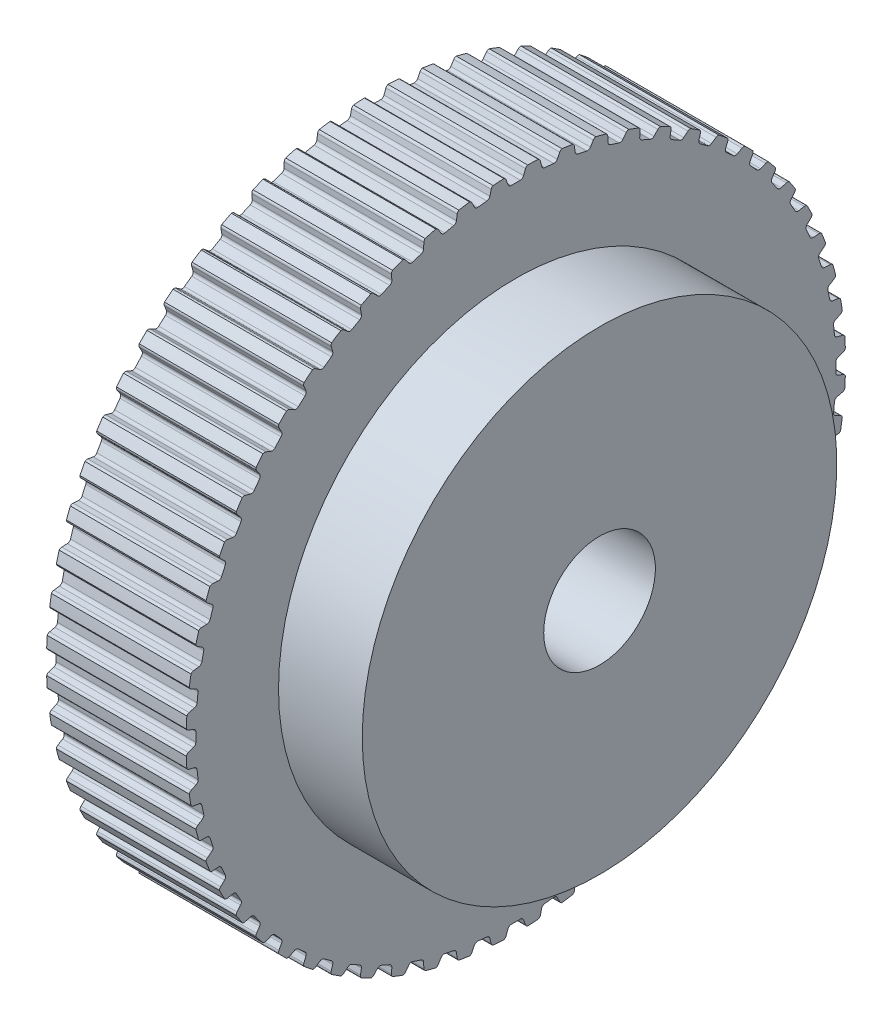
from build123d import *

# Parameters (mm, degrees)
BOSS_EXTRUDE1_DEPTH      = 10
SKETCH2_W                = 6
SKETCH2_H                = 17
F_8_0_8_DIAMETER_HOLE1_D = 8
FILLET1_R                = 0.25


with BuildPart() as part:
    # Sketch1 → Boss-Extrude1 (new body)
    with BuildSketch(Plane(origin=(0, 0, 0), x_dir=(0, -1, 0), z_dir=(-1, 0, 0))):
        with BuildLine():
            Line((-23.404623589, -1.761189424), (-22.851678683, -1.899054073))
            Line((-22.851678683, -1.899054073), (-22.74715022, -2.893575968))
            Line((-22.74715022, -2.893575968), (-23.25934828, -3.143391654))
            ThreePointArc((-23.25934828, -3.143391654), (-23.344028986, -3.210744018), (-23.392319429, -3.307569612))
            ThreePointArc((-23.392319429, -3.307569612), (-23.334137047, -3.695764237), (-23.269513044, -4.082938608))
            ThreePointArc((-23.269513044, -4.082938608), (-23.193665349, -4.160102654), (-23.092316188, -4.197990781))
            Line((-23.092316188, -4.197990781), (-22.527989592, -4.277301712))
            Line((-22.527989592, -4.277301712), (-22.320077901, -5.255449312))
            Line((-22.320077901, -5.255449312), (-22.803357238, -5.557435758))
            ThreePointArc((-22.803357238, -5.557435758), (-22.880533814, -5.633270702), (-22.918438687, -5.734613602))
            ThreePointArc((-22.918438687, -5.734613602), (-22.819997646, -6.114599941), (-22.715256919, -6.492898283))
            ThreePointArc((-22.715256919, -6.492898283), (-22.631758886, -6.561711373), (-22.527004538, -6.588798073))
            Line((-22.527004538, -6.588798073), (-21.957479133, -6.608686338))
            Line((-21.957479133, -6.608686338), (-21.648462139, -7.559742854))
            Line((-21.648462139, -7.559742854), (-22.097527841, -7.910591433))
            ThreePointArc((-22.097527841, -7.910591433), (-22.166354726, -7.994078094), (-22.193458734, -8.098827965))
            ThreePointArc((-22.193458734, -8.098827965), (-22.055837576, -8.466442808), (-21.912127685, -8.831720405))
            ThreePointArc((-21.912127685, -8.831720405), (-21.821894137, -8.891428609), (-21.714882313, -8.907417114))
            Line((-21.714882313, -8.907417114), (-21.146397938, -8.867664814))
            Line((-21.146397938, -8.867664814), (-20.739661295, -9.781210271))
            Line((-20.739661295, -9.781210271), (-21.149593306, -10.177077013))
            ThreePointArc((-21.149593306, -10.177077013), (-21.209316417, -10.267300694), (-21.225322604, -10.374309874))
            ThreePointArc((-21.225322604, -10.374309874), (-21.050029134, -10.725525556), (-20.868924595, -11.073780351))
            ThreePointArc((-20.868924595, -11.073780351), (-20.772944149, -11.123729492), (-20.664847293, -11.128444629))
            Line((-20.664847293, -11.128444629), (-20.103632382, -11.029487298))
            Line((-20.103632382, -11.029487298), (-19.603632382, -11.895512702))
            Line((-19.603632382, -11.895512702), (-19.9699394, -12.332060407))
            ThreePointArc((-19.9699394, -12.332060407), (-20.019904399, -12.428032598), (-20.024637397, -12.536128674))
            ThreePointArc((-20.024637397, -12.536128674), (-19.813592168, -12.867097202), (-19.5970772, -13.194513641))
            ThreePointArc((-19.5970772, -13.194513641), (-19.496401438, -13.234156467), (-19.388403882, -13.227546576))
            Line((-19.388403882, -13.227546576), (-18.840607222, -13.070468412))
            Line((-18.840607222, -13.070468412), (-18.25282197, -13.879485406))
            Line((-18.25282197, -13.879485406), (-18.571490659, -14.351931167))
            ThreePointArc((-18.571490659, -14.351931167), (-18.611150119, -14.452600377), (-18.604558073, -14.560599024))
            ThreePointArc((-18.604558073, -14.560599024), (-18.360073339, -14.867694239), (-18.110520126, -15.170685079))
            ThreePointArc((-18.110520126, -15.170685079), (-18.006252073, -15.199587255), (-17.899537061, -15.181724755))
            Line((-17.899537061, -15.181724755), (-17.371160427, -14.968246738))
            Line((-17.371160427, -14.968246738), (-16.702029821, -15.711391564))
            Line((-16.702029821, -15.711391564), (-16.96956878, -16.214559165))
            ThreePointArc((-16.96956878, -16.214559165), (-16.998488184, -16.318822442), (-16.980643317, -16.425540404))
            ThreePointArc((-16.980643317, -16.425540404), (-16.705397706, -16.705397706), (-16.425540404, -16.980643317))
            ThreePointArc((-16.425540404, -16.980643317), (-16.318822442, -16.998488184), (-16.214559165, -16.96956878))
            Line((-16.214559165, -16.96956878), (-15.711391564, -16.702029821))
            Line((-15.711391564, -16.702029821), (-14.968246738, -17.371160427))
            Line((-14.968246738, -17.371160427), (-15.181724755, -17.899537061))
            ThreePointArc((-15.181724755, -17.899537061), (-15.199587255, -18.006252073), (-15.170685079, -18.110520126))
            ThreePointArc((-15.170685079, -18.110520126), (-14.867694239, -18.360073339), (-14.560599024, -18.604558073))
            ThreePointArc((-14.560599024, -18.604558073), (-14.452600377, -18.611150119), (-14.351931167, -18.571490659))
            Line((-14.351931167, -18.571490659), (-13.879485406, -18.25282197))
            Line((-13.879485406, -18.25282197), (-13.070468412, -18.840607222))
            Line((-13.070468412, -18.840607222), (-13.227546576, -19.388403882))
            ThreePointArc((-13.227546576, -19.388403882), (-13.234156467, -19.496401438), (-13.194513641, -19.5970772))
            ThreePointArc((-13.194513641, -19.5970772), (-12.867097202, -19.813592168), (-12.536128674, -20.024637397))
            ThreePointArc((-12.536128674, -20.024637397), (-12.428032598, -20.019904399), (-12.332060407, -19.9699394))
            Line((-12.332060407, -19.9699394), (-11.895512702, -19.603632382))
            Line((-11.895512702, -19.603632382), (-11.029487298, -20.103632382))
            Line((-11.029487298, -20.103632382), (-11.128444629, -20.664847293))
            ThreePointArc((-11.128444629, -20.664847293), (-11.123729492, -20.772944149), (-11.073780351, -20.868924595))
            ThreePointArc((-11.073780351, -20.868924595), (-10.725525556, -21.050029134), (-10.374309874, -21.225322604))
            ThreePointArc((-10.374309874, -21.225322604), (-10.267300694, -21.209316417), (-10.177077013, -21.149593306))
            Line((-10.177077013, -21.149593306), (-9.781210271, -20.739661295))
            Line((-9.781210271, -20.739661295), (-8.867664814, -21.146397938))
            Line((-8.867664814, -21.146397938), (-8.907417114, -21.714882313))
            ThreePointArc((-8.907417114, -21.714882313), (-8.891428609, -21.821894137), (-8.831720405, -21.912127685))
            ThreePointArc((-8.831720405, -21.912127685), (-8.466442808, -22.055837576), (-8.098827965, -22.193458734))
            ThreePointArc((-8.098827965, -22.193458734), (-7.994078094, -22.166354726), (-7.910591433, -22.097527841))
            Line((-7.910591433, -22.097527841), (-7.559742854, -21.648462139))
            Line((-7.559742854, -21.648462139), (-6.608686338, -21.957479133))
            Line((-6.608686338, -21.957479133), (-6.588798073, -22.527004538))
            ThreePointArc((-6.588798073, -22.527004538), (-6.561711373, -22.631758886), (-6.492898283, -22.715256919))
            ThreePointArc((-6.492898283, -22.715256919), (-6.114599941, -22.819997646), (-5.734613602, -22.918438687))
            ThreePointArc((-5.734613602, -22.918438687), (-5.633270702, -22.880533814), (-5.557435758, -22.803357238))
            Line((-5.557435758, -22.803357238), (-5.255449312, -22.320077901))
            Line((-5.255449312, -22.320077901), (-4.277301712, -22.527989592))
            Line((-4.277301712, -22.527989592), (-4.197990781, -23.092316188))
            ThreePointArc((-4.197990781, -23.092316188), (-4.160102654, -23.193665349), (-4.082938608, -23.269513044))
            ThreePointArc((-4.082938608, -23.269513044), (-3.695764237, -23.334137047), (-3.307569612, -23.392319429))
            ThreePointArc((-3.307569612, -23.392319429), (-3.210744018, -23.344028986), (-3.143391654, -23.25934828))
            Line((-3.143391654, -23.25934828), (-2.893575968, -22.74715022))
            Line((-2.893575968, -22.74715022), (-1.899054073, -22.851678683))
            Line((-1.899054073, -22.851678683), (-1.761189424, -23.404623589))
            ThreePointArc((-1.761189424, -23.404623589), (-1.71291498, -23.501457161), (-1.628245404, -23.568823515))
            ThreePointArc((-1.628245404, -23.568823515), (-1.236436966, -23.592622759), (-0.844287198, -23.609909024))
            ThreePointArc((-0.844287198, -23.609909024), (-0.75303975, -23.55176209), (-0.694907893, -23.460505036))
            Line((-0.694907893, -23.460505036), (-0.5, -22.925))
            Line((-0.5, -22.925), (0.5, -22.925))
            Line((0.5, -22.925), (0.694907893, -23.460505036))
            ThreePointArc((0.694907893, -23.460505036), (0.75303975, -23.55176209), (0.844287198, -23.609909024))
            ThreePointArc((0.844287198, -23.609909024), (1.236436966, -23.592622759), (1.628245404, -23.568823515))
            ThreePointArc((1.628245404, -23.568823515), (1.71291498, -23.501457161), (1.761189424, -23.404623589))
            Line((1.761189424, -23.404623589), (1.899054073, -22.851678683))
            Line((1.899054073, -22.851678683), (2.893575968, -22.74715022))
            Line((2.893575968, -22.74715022), (3.143391654, -23.25934828))
            ThreePointArc((3.143391654, -23.25934828), (3.210744018, -23.344028986), (3.307569612, -23.392319429))
            ThreePointArc((3.307569612, -23.392319429), (3.695764237, -23.334137047), (4.082938608, -23.269513044))
            ThreePointArc((4.082938608, -23.269513044), (4.160102654, -23.193665349), (4.197990781, -23.092316188))
            Line((4.197990781, -23.092316188), (4.277301712, -22.527989592))
            Line((4.277301712, -22.527989592), (5.255449312, -22.320077901))
            Line((5.255449312, -22.320077901), (5.557435758, -22.803357238))
            ThreePointArc((5.557435758, -22.803357238), (5.633270702, -22.880533814), (5.734613602, -22.918438687))
            ThreePointArc((5.734613602, -22.918438687), (6.114599941, -22.819997646), (6.492898283, -22.715256919))
            ThreePointArc((6.492898283, -22.715256919), (6.561711373, -22.631758886), (6.588798073, -22.527004538))
            Line((6.588798073, -22.527004538), (6.608686338, -21.957479133))
            Line((6.608686338, -21.957479133), (7.559742854, -21.648462139))
            Line((7.559742854, -21.648462139), (7.910591433, -22.097527841))
            ThreePointArc((7.910591433, -22.097527841), (7.994078094, -22.166354726), (8.098827965, -22.193458734))
            ThreePointArc((8.098827965, -22.193458734), (8.466442808, -22.055837576), (8.831720405, -21.912127685))
            ThreePointArc((8.831720405, -21.912127685), (8.891428609, -21.821894137), (8.907417114, -21.714882313))
            Line((8.907417114, -21.714882313), (8.867664814, -21.146397938))
            Line((8.867664814, -21.146397938), (9.781210271, -20.739661295))
            Line((9.781210271, -20.739661295), (10.177077013, -21.149593306))
            ThreePointArc((10.177077013, -21.149593306), (10.267300694, -21.209316417), (10.374309874, -21.225322604))
            ThreePointArc((10.374309874, -21.225322604), (10.725525556, -21.050029134), (11.073780351, -20.868924595))
            ThreePointArc((11.073780351, -20.868924595), (11.123729492, -20.772944149), (11.128444629, -20.664847293))
            Line((11.128444629, -20.664847293), (11.029487298, -20.103632382))
            Line((11.029487298, -20.103632382), (11.895512702, -19.603632382))
            Line((11.895512702, -19.603632382), (12.332060407, -19.9699394))
            ThreePointArc((12.332060407, -19.9699394), (12.428032598, -20.019904399), (12.536128674, -20.024637397))
            ThreePointArc((12.536128674, -20.024637397), (12.867097202, -19.813592168), (13.194513641, -19.5970772))
            ThreePointArc((13.194513641, -19.5970772), (13.234156467, -19.496401438), (13.227546576, -19.388403882))
            Line((13.227546576, -19.388403882), (13.070468412, -18.840607222))
            Line((13.070468412, -18.840607222), (13.879485406, -18.25282197))
            Line((13.879485406, -18.25282197), (14.351931167, -18.571490659))
            ThreePointArc((14.351931167, -18.571490659), (14.452600377, -18.611150119), (14.560599024, -18.604558073))
            ThreePointArc((14.560599024, -18.604558073), (14.867694239, -18.360073339), (15.170685079, -18.110520126))
            ThreePointArc((15.170685079, -18.110520126), (15.199587255, -18.006252073), (15.181724755, -17.899537061))
            Line((15.181724755, -17.899537061), (14.968246738, -17.371160427))
            Line((14.968246738, -17.371160427), (15.711391564, -16.702029821))
            Line((15.711391564, -16.702029821), (16.214559165, -16.96956878))
            ThreePointArc((16.214559165, -16.96956878), (16.318822442, -16.998488184), (16.425540404, -16.980643317))
            ThreePointArc((16.425540404, -16.980643317), (16.705397706, -16.705397706), (16.980643317, -16.425540404))
            ThreePointArc((16.980643317, -16.425540404), (16.998488184, -16.318822442), (16.96956878, -16.214559165))
            Line((16.96956878, -16.214559165), (16.702029821, -15.711391564))
            Line((16.702029821, -15.711391564), (17.371160427, -14.968246738))
            Line((17.371160427, -14.968246738), (17.899537061, -15.181724755))
            ThreePointArc((17.899537061, -15.181724755), (18.006252073, -15.199587255), (18.110520126, -15.170685079))
            ThreePointArc((18.110520126, -15.170685079), (18.360073339, -14.867694239), (18.604558073, -14.560599024))
            ThreePointArc((18.604558073, -14.560599024), (18.611150119, -14.452600377), (18.571490659, -14.351931167))
            Line((18.571490659, -14.351931167), (18.25282197, -13.879485406))
            Line((18.25282197, -13.879485406), (18.840607222, -13.070468412))
            Line((18.840607222, -13.070468412), (19.388403882, -13.227546576))
            ThreePointArc((19.388403882, -13.227546576), (19.496401438, -13.234156467), (19.5970772, -13.194513641))
            ThreePointArc((19.5970772, -13.194513641), (19.813592168, -12.867097202), (20.024637397, -12.536128674))
            ThreePointArc((20.024637397, -12.536128674), (20.019904399, -12.428032598), (19.9699394, -12.332060407))
            Line((19.9699394, -12.332060407), (19.603632382, -11.895512702))
            Line((19.603632382, -11.895512702), (20.103632382, -11.029487298))
            Line((20.103632382, -11.029487298), (20.664847293, -11.128444629))
            ThreePointArc((20.664847293, -11.128444629), (20.772944149, -11.123729492), (20.868924595, -11.073780351))
            ThreePointArc((20.868924595, -11.073780351), (21.050029134, -10.725525556), (21.225322604, -10.374309874))
            ThreePointArc((21.225322604, -10.374309874), (21.209316417, -10.267300694), (21.149593306, -10.177077013))
            Line((21.149593306, -10.177077013), (20.739661295, -9.781210271))
            Line((20.739661295, -9.781210271), (21.146397938, -8.867664814))
            Line((21.146397938, -8.867664814), (21.714882313, -8.907417114))
            ThreePointArc((21.714882313, -8.907417114), (21.821894137, -8.891428609), (21.912127685, -8.831720405))
            ThreePointArc((21.912127685, -8.831720405), (22.055837576, -8.466442808), (22.193458734, -8.098827965))
            ThreePointArc((22.193458734, -8.098827965), (22.166354726, -7.994078094), (22.097527841, -7.910591433))
            Line((22.097527841, -7.910591433), (21.648462139, -7.559742854))
            Line((21.648462139, -7.559742854), (21.957479133, -6.608686338))
            Line((21.957479133, -6.608686338), (22.527004538, -6.588798073))
            ThreePointArc((22.527004538, -6.588798073), (22.631758886, -6.561711373), (22.715256919, -6.492898283))
            ThreePointArc((22.715256919, -6.492898283), (22.819997646, -6.114599941), (22.918438687, -5.734613602))
            ThreePointArc((22.918438687, -5.734613602), (22.880533814, -5.633270702), (22.803357238, -5.557435758))
            Line((22.803357238, -5.557435758), (22.320077901, -5.255449312))
            Line((22.320077901, -5.255449312), (22.527989592, -4.277301712))
            Line((22.527989592, -4.277301712), (23.092316188, -4.197990781))
            ThreePointArc((23.092316188, -4.197990781), (23.193665349, -4.160102654), (23.269513044, -4.082938608))
            ThreePointArc((23.269513044, -4.082938608), (23.334137047, -3.695764237), (23.392319429, -3.307569612))
            ThreePointArc((23.392319429, -3.307569612), (23.344028986, -3.210744018), (23.25934828, -3.143391654))
            Line((23.25934828, -3.143391654), (22.74715022, -2.893575968))
            Line((22.74715022, -2.893575968), (22.851678683, -1.899054073))
            Line((22.851678683, -1.899054073), (23.404623589, -1.761189424))
            ThreePointArc((23.404623589, -1.761189424), (23.501457161, -1.71291498), (23.568823515, -1.628245404))
            ThreePointArc((23.568823515, -1.628245404), (23.592622759, -1.236436966), (23.609909024, -0.844287198))
            ThreePointArc((23.609909024, -0.844287198), (23.55176209, -0.75303975), (23.460505036, -0.694907893))
            Line((23.460505036, -0.694907893), (22.925, -0.5))
            Line((22.925, -0.5), (22.925, 0.5))
            Line((22.925, 0.5), (23.460505036, 0.694907893))
            ThreePointArc((23.460505036, 0.694907893), (23.55176209, 0.75303975), (23.609909024, 0.844287198))
            ThreePointArc((23.609909024, 0.844287198), (23.592622759, 1.236436966), (23.568823515, 1.628245404))
            ThreePointArc((23.568823515, 1.628245404), (23.501457161, 1.71291498), (23.404623589, 1.761189424))
            Line((23.404623589, 1.761189424), (22.851678683, 1.899054073))
            Line((22.851678683, 1.899054073), (22.74715022, 2.893575968))
            Line((22.74715022, 2.893575968), (23.25934828, 3.143391654))
            ThreePointArc((23.25934828, 3.143391654), (23.344028986, 3.210744018), (23.392319429, 3.307569612))
            ThreePointArc((23.392319429, 3.307569612), (23.334137047, 3.695764237), (23.269513044, 4.082938608))
            ThreePointArc((23.269513044, 4.082938608), (23.193665349, 4.160102654), (23.092316188, 4.197990781))
            Line((23.092316188, 4.197990781), (22.527989592, 4.277301712))
            Line((22.527989592, 4.277301712), (22.320077901, 5.255449312))
            Line((22.320077901, 5.255449312), (22.803357238, 5.557435758))
            ThreePointArc((22.803357238, 5.557435758), (22.880533814, 5.633270702), (22.918438687, 5.734613602))
            ThreePointArc((22.918438687, 5.734613602), (22.819997646, 6.114599941), (22.715256919, 6.492898283))
            ThreePointArc((22.715256919, 6.492898283), (22.631758886, 6.561711373), (22.527004538, 6.588798073))
            Line((22.527004538, 6.588798073), (21.957479133, 6.608686338))
            Line((21.957479133, 6.608686338), (21.648462139, 7.559742854))
            Line((21.648462139, 7.559742854), (22.097527841, 7.910591433))
            ThreePointArc((22.097527841, 7.910591433), (22.166354726, 7.994078094), (22.193458734, 8.098827965))
            ThreePointArc((22.193458734, 8.098827965), (22.055837576, 8.466442808), (21.912127685, 8.831720405))
            ThreePointArc((21.912127685, 8.831720405), (21.821894137, 8.891428609), (21.714882313, 8.907417114))
            Line((21.714882313, 8.907417114), (21.146397938, 8.867664814))
            Line((21.146397938, 8.867664814), (20.739661295, 9.781210271))
            Line((20.739661295, 9.781210271), (21.149593306, 10.177077013))
            ThreePointArc((21.149593306, 10.177077013), (21.209316417, 10.267300694), (21.225322604, 10.374309874))
            ThreePointArc((21.225322604, 10.374309874), (21.050029134, 10.725525556), (20.868924595, 11.073780351))
            ThreePointArc((20.868924595, 11.073780351), (20.772944149, 11.123729492), (20.664847293, 11.128444629))
            Line((20.664847293, 11.128444629), (20.103632382, 11.029487298))
            Line((20.103632382, 11.029487298), (19.603632382, 11.895512702))
            Line((19.603632382, 11.895512702), (19.9699394, 12.332060407))
            ThreePointArc((19.9699394, 12.332060407), (20.019904399, 12.428032598), (20.024637397, 12.536128674))
            ThreePointArc((20.024637397, 12.536128674), (19.813592168, 12.867097202), (19.5970772, 13.194513641))
            ThreePointArc((19.5970772, 13.194513641), (19.496401438, 13.234156467), (19.388403882, 13.227546576))
            Line((19.388403882, 13.227546576), (18.840607222, 13.070468412))
            Line((18.840607222, 13.070468412), (18.25282197, 13.879485406))
            Line((18.25282197, 13.879485406), (18.571490659, 14.351931167))
            ThreePointArc((18.571490659, 14.351931167), (18.611150119, 14.452600377), (18.604558073, 14.560599024))
            ThreePointArc((18.604558073, 14.560599024), (18.360073339, 14.867694239), (18.110520126, 15.170685079))
            ThreePointArc((18.110520126, 15.170685079), (18.006252073, 15.199587255), (17.899537061, 15.181724755))
            Line((17.899537061, 15.181724755), (17.371160427, 14.968246738))
            Line((17.371160427, 14.968246738), (16.702029821, 15.711391564))
            Line((16.702029821, 15.711391564), (16.96956878, 16.214559165))
            ThreePointArc((16.96956878, 16.214559165), (16.998488184, 16.318822442), (16.980643317, 16.425540404))
            ThreePointArc((16.980643317, 16.425540404), (16.705397706, 16.705397706), (16.425540404, 16.980643317))
            ThreePointArc((16.425540404, 16.980643317), (16.318822442, 16.998488184), (16.214559165, 16.96956878))
            Line((16.214559165, 16.96956878), (15.711391564, 16.702029821))
            Line((15.711391564, 16.702029821), (14.968246738, 17.371160427))
            Line((14.968246738, 17.371160427), (15.181724755, 17.899537061))
            ThreePointArc((15.181724755, 17.899537061), (15.199587255, 18.006252073), (15.170685079, 18.110520126))
            ThreePointArc((15.170685079, 18.110520126), (14.867694239, 18.360073339), (14.560599024, 18.604558073))
            ThreePointArc((14.560599024, 18.604558073), (14.452600377, 18.611150119), (14.351931167, 18.571490659))
            Line((14.351931167, 18.571490659), (13.879485406, 18.25282197))
            Line((13.879485406, 18.25282197), (13.070468412, 18.840607222))
            Line((13.070468412, 18.840607222), (13.227546576, 19.388403882))
            ThreePointArc((13.227546576, 19.388403882), (13.234156467, 19.496401438), (13.194513641, 19.5970772))
            ThreePointArc((13.194513641, 19.5970772), (12.867097202, 19.813592168), (12.536128674, 20.024637397))
            ThreePointArc((12.536128674, 20.024637397), (12.428032598, 20.019904399), (12.332060407, 19.9699394))
            Line((12.332060407, 19.9699394), (11.895512702, 19.603632382))
            Line((11.895512702, 19.603632382), (11.029487298, 20.103632382))
            Line((11.029487298, 20.103632382), (11.128444629, 20.664847293))
            ThreePointArc((11.128444629, 20.664847293), (11.123729492, 20.772944149), (11.073780351, 20.868924595))
            ThreePointArc((11.073780351, 20.868924595), (10.725525556, 21.050029134), (10.374309874, 21.225322604))
            ThreePointArc((10.374309874, 21.225322604), (10.267300694, 21.209316417), (10.177077013, 21.149593306))
            Line((10.177077013, 21.149593306), (9.781210271, 20.739661295))
            Line((9.781210271, 20.739661295), (8.867664814, 21.146397938))
            Line((8.867664814, 21.146397938), (8.907417114, 21.714882313))
            ThreePointArc((8.907417114, 21.714882313), (8.891428609, 21.821894137), (8.831720405, 21.912127685))
            ThreePointArc((8.831720405, 21.912127685), (8.466442808, 22.055837576), (8.098827965, 22.193458734))
            ThreePointArc((8.098827965, 22.193458734), (7.994078094, 22.166354726), (7.910591433, 22.097527841))
            Line((7.910591433, 22.097527841), (7.559742854, 21.648462139))
            Line((7.559742854, 21.648462139), (6.608686338, 21.957479133))
            Line((6.608686338, 21.957479133), (6.588798073, 22.527004538))
            ThreePointArc((6.588798073, 22.527004538), (6.561711373, 22.631758886), (6.492898283, 22.715256919))
            ThreePointArc((6.492898283, 22.715256919), (6.114599941, 22.819997646), (5.734613602, 22.918438687))
            ThreePointArc((5.734613602, 22.918438687), (5.633270702, 22.880533814), (5.557435758, 22.803357238))
            Line((5.557435758, 22.803357238), (5.255449312, 22.320077901))
            Line((5.255449312, 22.320077901), (4.277301712, 22.527989592))
            Line((4.277301712, 22.527989592), (4.197990781, 23.092316188))
            ThreePointArc((4.197990781, 23.092316188), (4.160102654, 23.193665349), (4.082938608, 23.269513044))
            ThreePointArc((4.082938608, 23.269513044), (3.695764237, 23.334137047), (3.307569612, 23.392319429))
            ThreePointArc((3.307569612, 23.392319429), (3.210744018, 23.344028986), (3.143391654, 23.25934828))
            Line((3.143391654, 23.25934828), (2.893575968, 22.74715022))
            Line((2.893575968, 22.74715022), (1.899054073, 22.851678683))
            Line((1.899054073, 22.851678683), (1.761189424, 23.404623589))
            ThreePointArc((1.761189424, 23.404623589), (1.71291498, 23.501457161), (1.628245404, 23.568823515))
            ThreePointArc((1.628245404, 23.568823515), (1.236436966, 23.592622759), (0.844287198, 23.609909024))
            ThreePointArc((0.844287198, 23.609909024), (0.75303975, 23.55176209), (0.694907893, 23.460505036))
            Line((0.694907893, 23.460505036), (0.5, 22.925))
            Line((0.5, 22.925), (-0.5, 22.925))
            Line((-0.5, 22.925), (-0.694907893, 23.460505036))
            ThreePointArc((-0.694907893, 23.460505036), (-0.75303975, 23.55176209), (-0.844287198, 23.609909024))
            ThreePointArc((-0.844287198, 23.609909024), (-1.236436966, 23.592622759), (-1.628245404, 23.568823515))
            ThreePointArc((-1.628245404, 23.568823515), (-1.71291498, 23.501457161), (-1.761189424, 23.404623589))
            Line((-1.761189424, 23.404623589), (-1.899054073, 22.851678683))
            Line((-1.899054073, 22.851678683), (-2.893575968, 22.74715022))
            Line((-2.893575968, 22.74715022), (-3.143391654, 23.25934828))
            ThreePointArc((-3.143391654, 23.25934828), (-3.210744018, 23.344028986), (-3.307569612, 23.392319429))
            ThreePointArc((-3.307569612, 23.392319429), (-3.695764237, 23.334137047), (-4.082938608, 23.269513044))
            ThreePointArc((-4.082938608, 23.269513044), (-4.160102654, 23.193665349), (-4.197990781, 23.092316188))
            Line((-4.197990781, 23.092316188), (-4.277301712, 22.527989592))
            Line((-4.277301712, 22.527989592), (-5.255449312, 22.320077901))
            Line((-5.255449312, 22.320077901), (-5.557435758, 22.803357238))
            ThreePointArc((-5.557435758, 22.803357238), (-5.633270702, 22.880533814), (-5.734613602, 22.918438687))
            ThreePointArc((-5.734613602, 22.918438687), (-6.114599941, 22.819997646), (-6.492898283, 22.715256919))
            ThreePointArc((-6.492898283, 22.715256919), (-6.561711373, 22.631758886), (-6.588798073, 22.527004538))
            Line((-6.588798073, 22.527004538), (-6.608686338, 21.957479133))
            Line((-6.608686338, 21.957479133), (-7.559742854, 21.648462139))
            Line((-7.559742854, 21.648462139), (-7.910591433, 22.097527841))
            ThreePointArc((-7.910591433, 22.097527841), (-7.994078094, 22.166354726), (-8.098827965, 22.193458734))
            ThreePointArc((-8.098827965, 22.193458734), (-8.466442808, 22.055837576), (-8.831720405, 21.912127685))
            ThreePointArc((-8.831720405, 21.912127685), (-8.891428609, 21.821894137), (-8.907417114, 21.714882313))
            Line((-8.907417114, 21.714882313), (-8.867664814, 21.146397938))
            Line((-8.867664814, 21.146397938), (-9.781210271, 20.739661295))
            Line((-9.781210271, 20.739661295), (-10.177077013, 21.149593306))
            ThreePointArc((-10.177077013, 21.149593306), (-10.267300694, 21.209316417), (-10.374309874, 21.225322604))
            ThreePointArc((-10.374309874, 21.225322604), (-10.725525556, 21.050029134), (-11.073780351, 20.868924595))
            ThreePointArc((-11.073780351, 20.868924595), (-11.123729492, 20.772944149), (-11.128444629, 20.664847293))
            Line((-11.128444629, 20.664847293), (-11.029487298, 20.103632382))
            Line((-11.029487298, 20.103632382), (-11.895512702, 19.603632382))
            Line((-11.895512702, 19.603632382), (-12.332060407, 19.9699394))
            ThreePointArc((-12.332060407, 19.9699394), (-12.428032598, 20.019904399), (-12.536128674, 20.024637397))
            ThreePointArc((-12.536128674, 20.024637397), (-12.867097202, 19.813592168), (-13.194513641, 19.5970772))
            ThreePointArc((-13.194513641, 19.5970772), (-13.234156467, 19.496401438), (-13.227546576, 19.388403882))
            Line((-13.227546576, 19.388403882), (-13.070468412, 18.840607222))
            Line((-13.070468412, 18.840607222), (-13.879485406, 18.25282197))
            Line((-13.879485406, 18.25282197), (-14.351931167, 18.571490659))
            ThreePointArc((-14.351931167, 18.571490659), (-14.452600377, 18.611150119), (-14.560599024, 18.604558073))
            ThreePointArc((-14.560599024, 18.604558073), (-14.867694239, 18.360073339), (-15.170685079, 18.110520126))
            ThreePointArc((-15.170685079, 18.110520126), (-15.199587255, 18.006252073), (-15.181724755, 17.899537061))
            Line((-15.181724755, 17.899537061), (-14.968246738, 17.371160427))
            Line((-14.968246738, 17.371160427), (-15.711391564, 16.702029821))
            Line((-15.711391564, 16.702029821), (-16.214559165, 16.96956878))
            ThreePointArc((-16.214559165, 16.96956878), (-16.318822442, 16.998488184), (-16.425540404, 16.980643317))
            ThreePointArc((-16.425540404, 16.980643317), (-16.705397706, 16.705397706), (-16.980643317, 16.425540404))
            ThreePointArc((-16.980643317, 16.425540404), (-16.998488184, 16.318822442), (-16.96956878, 16.214559165))
            Line((-16.96956878, 16.214559165), (-16.702029821, 15.711391564))
            Line((-16.702029821, 15.711391564), (-17.371160427, 14.968246738))
            Line((-17.371160427, 14.968246738), (-17.899537061, 15.181724755))
            ThreePointArc((-17.899537061, 15.181724755), (-18.006252073, 15.199587255), (-18.110520126, 15.170685079))
            ThreePointArc((-18.110520126, 15.170685079), (-18.360073339, 14.867694239), (-18.604558073, 14.560599024))
            ThreePointArc((-18.604558073, 14.560599024), (-18.611150119, 14.452600377), (-18.571490659, 14.351931167))
            Line((-18.571490659, 14.351931167), (-18.25282197, 13.879485406))
            Line((-18.25282197, 13.879485406), (-18.840607222, 13.070468412))
            Line((-18.840607222, 13.070468412), (-19.388403882, 13.227546576))
            ThreePointArc((-19.388403882, 13.227546576), (-19.496401438, 13.234156467), (-19.5970772, 13.194513641))
            ThreePointArc((-19.5970772, 13.194513641), (-19.813592168, 12.867097202), (-20.024637397, 12.536128674))
            ThreePointArc((-20.024637397, 12.536128674), (-20.019904399, 12.428032598), (-19.9699394, 12.332060407))
            Line((-19.9699394, 12.332060407), (-19.603632382, 11.895512702))
            Line((-19.603632382, 11.895512702), (-20.103632382, 11.029487298))
            Line((-20.103632382, 11.029487298), (-20.664847293, 11.128444629))
            ThreePointArc((-20.664847293, 11.128444629), (-20.772944149, 11.123729492), (-20.868924595, 11.073780351))
            ThreePointArc((-20.868924595, 11.073780351), (-21.050029134, 10.725525556), (-21.225322604, 10.374309874))
            ThreePointArc((-21.225322604, 10.374309874), (-21.209316417, 10.267300694), (-21.149593306, 10.177077013))
            Line((-21.149593306, 10.177077013), (-20.739661295, 9.781210271))
            Line((-20.739661295, 9.781210271), (-21.146397938, 8.867664814))
            Line((-21.146397938, 8.867664814), (-21.714882313, 8.907417114))
            ThreePointArc((-21.714882313, 8.907417114), (-21.821894137, 8.891428609), (-21.912127685, 8.831720405))
            ThreePointArc((-21.912127685, 8.831720405), (-22.055837576, 8.466442808), (-22.193458734, 8.098827965))
            ThreePointArc((-22.193458734, 8.098827965), (-22.166354726, 7.994078094), (-22.097527841, 7.910591433))
            Line((-22.097527841, 7.910591433), (-21.648462139, 7.559742854))
            Line((-21.648462139, 7.559742854), (-21.957479133, 6.608686338))
            Line((-21.957479133, 6.608686338), (-22.527004538, 6.588798073))
            ThreePointArc((-22.527004538, 6.588798073), (-22.631758886, 6.561711373), (-22.715256919, 6.492898283))
            ThreePointArc((-22.715256919, 6.492898283), (-22.819997646, 6.114599941), (-22.918438687, 5.734613602))
            ThreePointArc((-22.918438687, 5.734613602), (-22.880533814, 5.633270702), (-22.803357238, 5.557435758))
            Line((-22.803357238, 5.557435758), (-22.320077901, 5.255449312))
            Line((-22.320077901, 5.255449312), (-22.527989592, 4.277301712))
            Line((-22.527989592, 4.277301712), (-23.092316188, 4.197990781))
            ThreePointArc((-23.092316188, 4.197990781), (-23.193665349, 4.160102654), (-23.269513044, 4.082938608))
            ThreePointArc((-23.269513044, 4.082938608), (-23.334137047, 3.695764237), (-23.392319429, 3.307569612))
            ThreePointArc((-23.392319429, 3.307569612), (-23.344028986, 3.210744018), (-23.25934828, 3.143391654))
            Line((-23.25934828, 3.143391654), (-22.74715022, 2.893575968))
            Line((-22.74715022, 2.893575968), (-22.851678683, 1.899054073))
            Line((-22.851678683, 1.899054073), (-23.404623589, 1.761189424))
            ThreePointArc((-23.404623589, 1.761189424), (-23.501457161, 1.71291498), (-23.568823515, 1.628245404))
            ThreePointArc((-23.568823515, 1.628245404), (-23.592622759, 1.236436966), (-23.609909024, 0.844287198))
            ThreePointArc((-23.609909024, 0.844287198), (-23.55176209, 0.75303975), (-23.460505036, 0.694907893))
            Line((-23.460505036, 0.694907893), (-22.925, 0.5))
            Line((-22.925, 0.5), (-22.925, -0.5))
            Line((-22.925, -0.5), (-23.460505036, -0.694907893))
            ThreePointArc((-23.460505036, -0.694907893), (-23.55176209, -0.75303975), (-23.609909024, -0.844287198))
            ThreePointArc((-23.609909024, -0.844287198), (-23.592622759, -1.236436966), (-23.568823515, -1.628245404))
            ThreePointArc((-23.568823515, -1.628245404), (-23.501457161, -1.71291498), (-23.404623589, -1.761189424))
        make_face()
    extrude(amount=-BOSS_EXTRUDE1_DEPTH)

    # Sketch2 → Revolve1 (revolve)
    with BuildSketch(Plane(origin=(0, 0, 0), x_dir=(-1, 0, 0), z_dir=(0, 0, -1))):
        with Locations((-13, 8.5)):
            Rectangle(SKETCH2_W, SKETCH2_H)
    revolve(axis=Axis((16, 0, 0), (-1, 0, 0)))

    # Ø8.0 (8) Diameter Hole1 (through all)
    with Locations(Plane.ZY):
        with Locations((0, 0)):
            Hole(F_8_0_8_DIAMETER_HOLE1_D / 2)

    # Fillet1
    fillet1_edges = [part.edges().sort_by_distance(p)[0] for p in [
        (5, -22.851678683, -1.899054073),
        (5, 4.277301712, -22.527989592),
        (5, -13.879485406, -18.25282197),
        (5, 19.603632382, -11.895512702),
        (5, 22.925, 0.5),
        (5, -20.103632382, -11.029487298),
        (5, 22.925, -0.5),
        (5, -5.255449312, -22.320077901),
        (5, 13.070468412, -18.840607222),
        (5, 22.74715022, -2.893575968),
        (5, 22.74715022, 2.893575968),
        (5, -21.957479133, -6.608686338),
        (5, 22.851678683, 1.899054073),
        (5, -17.371160427, -14.968246738),
        (5, -9.781210271, -20.739661295),
        (5, -0.5, -22.925),
        (5, 22.320077901, 5.255449312),
        (5, 8.867664814, -21.146397938),
        (5, 22.527989592, 4.277301712),
        (5, 16.702029821, -15.711391564),
        (5, 21.648462139, -7.559742854),
        (5, -22.925, 0.5),
        (5, 21.648462139, 7.559742854),
        (5, -22.527989592, -4.277301712),
        (5, 21.957479133, 6.608686338),
        (5, -21.146397938, -8.867664814),
        (5, -18.840607222, -13.070468412),
        (5, -15.711391564, -16.702029821),
        (5, 20.739661295, 9.781210271),
        (5, -11.895512702, -19.603632382),
        (5, 21.146397938, 8.867664814),
        (5, -7.559742854, -21.648462139),
        (5, -2.893575968, -22.74715022),
        (5, 1.899054073, -22.851678683),
        (5, 19.603632382, 11.895512702),
        (5, 6.608686338, -21.957479133),
        (5, 20.103632382, 11.029487298),
        (5, 11.029487298, -20.103632382),
        (5, 14.968246738, -17.371160427),
        (5, 18.25282197, -13.879485406),
        (5, 18.25282197, 13.879485406),
        (5, 20.739661295, -9.781210271),
        (5, 18.840607222, 13.070468412),
        (5, 22.320077901, -5.255449312),
        (5, 16.702029821, 15.711391564),
        (5, 17.371160427, 14.968246738),
        (5, 14.968246738, 17.371160427),
        (5, 15.711391564, 16.702029821),
        (5, 13.070468412, 18.840607222),
        (5, 13.879485406, 18.25282197),
        (5, 11.029487298, 20.103632382),
        (5, 11.895512702, 19.603632382),
        (5, 8.867664814, 21.146397938),
        (5, 9.781210271, 20.739661295),
        (5, 6.608686338, 21.957479133),
        (5, 7.559742854, 21.648462139),
        (5, 4.277301712, 22.527989592),
        (5, 5.255449312, 22.320077901),
        (5, 1.899054073, 22.851678683),
        (5, 2.893575968, 22.74715022),
        (5, -22.925, -0.5),
        (5, -22.74715022, -2.893575968),
        (5, -0.5, 22.925),
        (5, 0.5, 22.925),
        (5, -22.320077901, -5.255449312),
        (5, -21.648462139, -7.559742854),
        (5, -2.893575968, 22.74715022),
        (5, -1.899054073, 22.851678683),
        (5, -20.739661295, -9.781210271),
        (5, -19.603632382, -11.895512702),
        (5, -5.255449312, 22.320077901),
        (5, -4.277301712, 22.527989592),
        (5, -18.25282197, -13.879485406),
        (5, -16.702029821, -15.711391564),
        (5, -7.559742854, 21.648462139),
        (5, -6.608686338, 21.957479133),
        (5, -14.968246738, -17.371160427),
        (5, -13.070468412, -18.840607222),
        (5, -9.781210271, 20.739661295),
        (5, -8.867664814, 21.146397938),
        (5, -11.029487298, -20.103632382),
        (5, -8.867664814, -21.146397938),
        (5, -11.895512702, 19.603632382),
        (5, -11.029487298, 20.103632382),
        (5, -6.608686338, -21.957479133),
        (5, -4.277301712, -22.527989592),
        (5, -13.879485406, 18.25282197),
        (5, -13.070468412, 18.840607222),
        (5, -1.899054073, -22.851678683),
        (5, 0.5, -22.925),
        (5, -15.711391564, 16.702029821),
        (5, -14.968246738, 17.371160427),
        (5, 2.893575968, -22.74715022),
        (5, 5.255449312, -22.320077901),
        (5, -17.371160427, 14.968246738),
        (5, -16.702029821, 15.711391564),
        (5, 7.559742854, -21.648462139),
        (5, 9.781210271, -20.739661295),
        (5, -18.840607222, 13.070468412),
        (5, -18.25282197, 13.879485406),
        (5, 11.895512702, -19.603632382),
        (5, 13.879485406, -18.25282197),
        (5, -20.103632382, 11.029487298),
        (5, -19.603632382, 11.895512702),
        (5, 15.711391564, -16.702029821),
        (5, 17.371160427, -14.968246738),
        (5, -21.146397938, 8.867664814),
        (5, -20.739661295, 9.781210271),
        (5, 18.840607222, -13.070468412),
        (5, 20.103632382, -11.029487298),
        (5, -21.957479133, 6.608686338),
        (5, -21.648462139, 7.559742854),
        (5, 21.146397938, -8.867664814),
        (5, 21.957479133, -6.608686338),
        (5, -22.527989592, 4.277301712),
        (5, -22.320077901, 5.255449312),
        (5, 22.527989592, -4.277301712),
        (5, 22.851678683, -1.899054073),
        (5, -22.851678683, 1.899054073),
        (5, -22.74715022, 2.893575968),
    ]]
    fillet(fillet1_edges, radius=FILLET1_R)


solid = part.part
